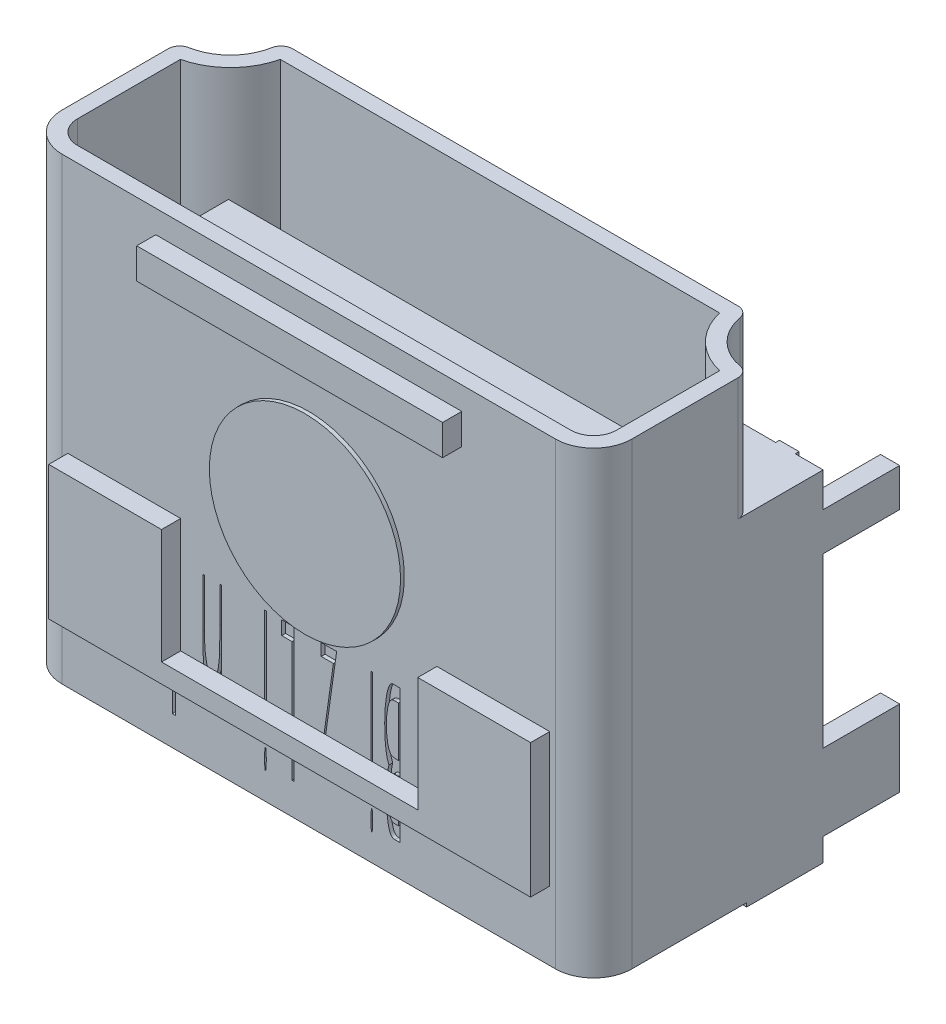
from build123d import *

# Parameters (mm, degrees)
SKETCH_1_W                     = 14.9
SKETCH_1_H                     = 12
EXTRUDE_1_DEPTH                = 6
FILLET_1_R                     = 1
SKETCH_2_W                     = 14.9
SKETCH_2_H                     = 0.6
CUT_EXTRUDE_1_DEPTH            = 3.2
SKETCH_3_R                     = 1.352822973
CUT_EXTRUDE_2_DEPTH            = 3.2
FILLET_2_R                     = 0.3
CUT_EXTRUDE_3_DEPTH            = 6
SKETCH_5_W                     = 10.5
SKETCH_5_H                     = 0.9
EXTRUDE_2_DEPTH                = 4
SKETCH_6_W                     = 0.5
SKETCH_6_H                     = 1
EXTRUDE_3_DEPTH                = 2
SKETCH_7_W                     = 0.5
SKETCH_7_H                     = 2
EXTRUDE_4_DEPTH                = 2
SKETCH_8_W                     = 11
SKETCH_8_H                     = 2
CUT_EXTRUDE_4_DEPTH            = 1.5
SKETCH_9_W                     = 0.3
SKETCH_9_H                     = 2
EXTRUDE_5_DEPTH                = 0.2
SKETCH_10_W                    = 0.3
SKETCH_10_H                    = 1.3
EXTRUDE_6_DEPTH                = 0.2
FILLET_3_R                     = 0.1
PATTERN_LINEAR_1_COUNT         = 21
PATTERN_LINEAR_1_PITCH         = 0.5
FILLET_3_OF_PATTERN_LINEAR_1_R = 0.1
SKETCH_11_W                    = 1.95
SKETCH_11_H                    = 2
EXTRUDE_7_DEPTH                = 0.1
SKETCH_12_W                    = 0.514362924
SKETCH_12_H                    = 8.8
EXTRUDE_8_DEPTH                = 0.1
WRAP_START                     = -0.1
WRAP_2_OUTLINE_W               = 0.044871794
WRAP_2_OUTLINE_H               = 2.557692308
WRAP_2_OUTLINE_W_2             = 0.044871795
WRAP_2_DEPTH                   = 0.1
WRAP_3_DEPTH                   = 0.1
SKETCH_16_W                    = 8
SKETCH_16_H                    = 0.8
EXTRUDE_9_DEPTH                = 0.5
SKETCH_17_R                    = 2.5
EXTRUDE_10_DEPTH               = 0.1


# Read off the part's stored shape, not the designer's step: 包覆2, 包覆3
with BuildPart() as part:
    # 草图1 → 凸台-拉伸1 (new body)
    with BuildSketch(Plane.XY):
        with Locations((7.45, 6)):
            Rectangle(SKETCH_1_W, SKETCH_1_H)
    extrude(amount=EXTRUDE_1_DEPTH)

    # 圆角1
    fillet_1_edges = [part.edges().sort_by_distance(p)[0] for p in [
        (14.9, 6, 6),
        (0, 6, 6),
    ]]
    fillet(fillet_1_edges, radius=FILLET_1_R)

    # 草图2 → 切除-拉伸1 (cut)
    with BuildSketch(Plane(origin=(0, 12, 0), x_dir=(1, 0, 0), z_dir=(0, 1, 0))):
        with Locations((7.45, -0.3)):
            Rectangle(SKETCH_2_W, SKETCH_2_H)
    extrude(amount=-CUT_EXTRUDE_1_DEPTH, mode=Mode.SUBTRACT)

    # 草图3 → 切除-拉伸2 (cut)
    with BuildSketch(Plane(origin=(0, 12, 0), x_dir=(1, 0, 0), z_dir=(0, 1, 0))):
        with Locations((14.9, -0.6)):
            Circle(SKETCH_3_R)
        with Locations((0, -0.6)):
            Circle(SKETCH_3_R)
    extrude(amount=-CUT_EXTRUDE_2_DEPTH, mode=Mode.SUBTRACT)

    # 圆角2
    fillet_2_edges = [part.edges().sort_by_distance(p)[0] for p in [
        (14.9, 10.4, 1.952822973),
        (13.547177027, 10.4, 0.6),
        (0, 10.4, 1.952822973),
        (1.352822973, 10.4, 0.6),
    ]]
    fillet(fillet_2_edges, radius=FILLET_2_R)

    # 草图4 → 切除-拉伸3 (cut)
    with BuildSketch(Plane(origin=(0, 12, 0), x_dir=(1, 0, 0), z_dir=(0, 1, 0))):
        with BuildLine():
            Line((0.4, -2.306572113), (0.4, -5))
            ThreePointArc((0.4, -5), (0.575735931, -5.424264069), (1, -5.6))
            Line((1, -5.6), (13.9, -5.6))
            ThreePointArc((13.9, -5.6), (14.324264069, -5.424264069), (14.5, -5))
            Line((14.5, -5), (14.5, -2.306572113))
            ThreePointArc((14.5, -2.306572113), (13.660566989, -1.839433011), (13.193427887, -1))
            Line((13.193427887, -1), (1.706572113, -1))
            ThreePointArc((1.706572113, -1), (1.239433011, -1.839433011), (0.4, -2.306572113))
        make_face()
    extrude(amount=-CUT_EXTRUDE_3_DEPTH, mode=Mode.SUBTRACT)

    # 草图5 → 凸台-拉伸2 (add)
    with BuildSketch(Plane(origin=(0, 6, 0), x_dir=(1, 0, 0), z_dir=(0, 1, 0))):
        with Locations((7.45, -3.3)):
            Rectangle(SKETCH_5_W, SKETCH_5_H)
    extrude(amount=EXTRUDE_2_DEPTH)

    # 草图6 → 凸台-拉伸3 (add)
    with BuildSketch(Plane(origin=(0, 0, 0), x_dir=(-1, 0, 0), z_dir=(0, 0, -1))):
        with Locations((-14.65, 7.4)):
            Rectangle(SKETCH_6_W, SKETCH_6_H)
        with Locations((-0.25, 7.4)):
            Rectangle(SKETCH_6_W, SKETCH_6_H)
    extrude(amount=EXTRUDE_3_DEPTH)

    # 草图7 → 凸台-拉伸4 (add)
    with BuildSketch(Plane(origin=(0, 0, 0), x_dir=(-1, 0, 0), z_dir=(0, 0, -1))):
        with Locations((-14.65, 1.5)):
            Rectangle(SKETCH_7_W, SKETCH_7_H)
        with Locations((-0.25, 1.5)):
            Rectangle(SKETCH_7_W, SKETCH_7_H)
    extrude(amount=EXTRUDE_4_DEPTH)

    # 草图8 → 切除-拉伸4 (cut)
    with BuildSketch(Plane.XZ):
        with Locations((7.45, 1)):
            Rectangle(SKETCH_8_W, SKETCH_8_H)
    extrude(amount=-CUT_EXTRUDE_4_DEPTH, mode=Mode.SUBTRACT)


with BuildPart() as body_2:
    # 草图9 → 凸台-拉伸5 (new body)
    with BuildSketch(Plane.XZ.offset(-1.5)):
        with Locations((2.5, 1)):
            Rectangle(SKETCH_9_W, SKETCH_9_H)
    extrude_5 = extrude(amount=EXTRUDE_5_DEPTH)


with BuildPart() as body_3:
    # 草图10 → 凸台-拉伸6 (new body)
    with BuildSketch(Plane(origin=(0, 0, 0), x_dir=(-1, 0, 0), z_dir=(0, 0, -1))):
        with Locations((-2.5, 0.85)):
            Rectangle(SKETCH_10_W, SKETCH_10_H)
    extrude_6 = extrude(amount=EXTRUDE_6_DEPTH)

    # 圆角3
    fillet_3_edges = [body_3.edges().sort_by_distance(p)[0] for p in [
        (2.35, 0.2, -0.1),
        (2.65, 0.2, -0.1),
    ]]
    fillet(fillet_3_edges, radius=FILLET_3_R)


with BuildPart() as part_1:
    add(part.part)

    # 阵列(线性)1: 凸台-拉伸5, 凸台-拉伸6 ×21
    with Locations(*[(i * PATTERN_LINEAR_1_PITCH, 0, 0) for i in range(1, PATTERN_LINEAR_1_COUNT)]):
        add(extrude_5)
        add(extrude_6)

    # 圆角3 of 阵列(线性)1
    fillet_3_of_pattern_linear_1_edges = [part_1.edges().sort_by_distance(p)[0] for p in [
        (2.85, 0.2, -0.1),
        (3.15, 0.2, -0.1),
        (3.35, 0.2, -0.1),
        (3.65, 0.2, -0.1),
        (3.85, 0.2, -0.1),
        (4.15, 0.2, -0.1),
        (4.35, 0.2, -0.1),
        (4.65, 0.2, -0.1),
        (4.85, 0.2, -0.1),
        (5.15, 0.2, -0.1),
        (5.35, 0.2, -0.1),
        (5.65, 0.2, -0.1),
        (5.85, 0.2, -0.1),
        (6.15, 0.2, -0.1),
        (6.35, 0.2, -0.1),
        (6.65, 0.2, -0.1),
        (6.85, 0.2, -0.1),
        (7.15, 0.2, -0.1),
        (7.35, 0.2, -0.1),
        (7.65, 0.2, -0.1),
        (7.85, 0.2, -0.1),
        (8.15, 0.2, -0.1),
        (8.35, 0.2, -0.1),
        (8.65, 0.2, -0.1),
        (8.85, 0.2, -0.1),
        (9.15, 0.2, -0.1),
        (9.35, 0.2, -0.1),
        (9.65, 0.2, -0.1),
        (9.85, 0.2, -0.1),
        (10.15, 0.2, -0.1),
        (10.35, 0.2, -0.1),
        (10.65, 0.2, -0.1),
        (10.85, 0.2, -0.1),
        (11.15, 0.2, -0.1),
        (11.35, 0.2, -0.1),
        (11.65, 0.2, -0.1),
        (11.85, 0.2, -0.1),
        (12.15, 0.2, -0.1),
        (12.35, 0.2, -0.1),
        (12.65, 0.2, -0.1),
    ]]
    fillet(fillet_3_of_pattern_linear_1_edges, radius=FILLET_3_OF_PATTERN_LINEAR_1_R)

    # 草图11 → 凸台-拉伸7 (add)
    with BuildSketch(Plane.XZ):
        with Locations((0.975, 1)):
            Rectangle(SKETCH_11_W, SKETCH_11_H)
        with Locations((13.925, 1)):
            Rectangle(SKETCH_11_W, SKETCH_11_H)
    extrude(amount=EXTRUDE_7_DEPTH)

    # 草图12 → 凸台-拉伸8 (add)
    with BuildSketch(Plane(origin=(0, 0, 0), x_dir=(-1, 0, 0), z_dir=(0, 0, -1))):
        with Locations((-0.986599774, 4.4)):
            Rectangle(SKETCH_12_W, SKETCH_12_H)
        with Locations((-13.913400226, 4.4)):
            Rectangle(SKETCH_12_W, SKETCH_12_H)
    extrude(amount=EXTRUDE_8_DEPTH)

    # 包覆2 outline → 包覆2 (cut)
    # profile 1 of 8: a face of its own
    with BuildSketch(Plane.XY.offset(6).offset(WRAP_START)):
        with BuildLine():
            add(Edge.make_bspline(
                [(5.127653544, 2.231309328), (5.120128489, 2.190086865), (5.106127643, 2.11338984), (5.080573314, 2.008013876), (5.055820157, 1.919845149), (5.027786579, 1.849743187), (4.999147669, 1.795513261), (4.969496906, 1.756456903), (4.936784986, 1.73045949), (4.912512621, 1.726804294), (4.901191204, 1.725099392)],
                knots=[0, 0, 0, 0, 0.216322627, 0.40248206, 0.559800951, 0.68865692, 0.791807792, 0.875111536, 0.941747975, 1, 1, 1, 1], degree=3))
            Line((5.127653544, 2.231309328), (5.127653544, 1.769971187))
            Line((5.127653544, 1.769971187), (5.172525339, 1.769971187))
            Line((5.172525339, 1.769971187), (5.172525339, 4.327663495))
            Line((5.172525339, 4.327663495), (5.127653544, 4.327663495))
            Line((5.127653544, 4.327663495), (5.127653544, 3.402883847))
            add(Edge.make_bspline(
                [(5.117136717, 2.71648561), (5.118141634, 2.733776619), (5.120340539, 2.771611863), (5.12227538, 2.83309481), (5.123510434, 2.904385019), (5.124889914, 2.985248055), (5.126514164, 3.075921921), (5.126877491, 3.176188458), (5.127876056, 3.286262328), (5.127729795, 3.362919614), (5.127653544, 3.402883847)],
                knots=[0, 0, 0, 0, 0.075680799, 0.1656006, 0.26876431, 0.387243745, 0.518997301, 0.665035713, 0.825370924, 1, 1, 1, 1], degree=3))
            add(Edge.make_bspline(
                [(4.922224858, 2.039201956), (4.927942359, 2.039756298), (4.94007378, 2.040932504), (4.957314872, 2.051140953), (4.973530839, 2.067143837), (4.988699721, 2.089259602), (5.003159713, 2.116996656), (5.018282565, 2.150267915), (5.031587289, 2.190194601), (5.051033274, 2.252612992), (5.072011625, 2.340441994), (5.092057996, 2.455425088), (5.107328091, 2.582067052), (5.113774701, 2.670412155), (5.117136717, 2.71648561)],
                knots=[0, 0, 0, 0, 0.023338468, 0.049519672, 0.080048927, 0.116511341, 0.158998822, 0.208376928, 0.266319586, 0.331552586, 0.476722505, 0.636472639, 0.810414377, 1, 1, 1, 1], degree=3))
            add(Edge.make_bspline(
                [(4.749047775, 2.542607405), (4.755021423, 2.503284071), (4.766179616, 2.429831905), (4.78671122, 2.327985836), (4.803874752, 2.241064936), (4.822525459, 2.169775389), (4.842033901, 2.113583712), (4.863842906, 2.072756404), (4.890324151, 2.044482028), (4.912204948, 2.04086041), (4.922224858, 2.039201956)],
                knots=[0, 0, 0, 0, 0.215270019, 0.402103472, 0.562391593, 0.694657174, 0.801124103, 0.882722838, 0.94629507, 1, 1, 1, 1], degree=3))
            add(Edge.make_bspline(
                [(4.72380739, 3.124538495), (4.724074831, 3.089716639), (4.72458638, 3.023110932), (4.724788669, 2.92774349), (4.727114487, 2.84150561), (4.729797532, 2.764137428), (4.733287633, 2.69588777), (4.737145917, 2.636455185), (4.742808624, 2.586463153), (4.747120507, 2.556154401), (4.749047775, 2.542607405)],
                knots=[0, 0, 0, 0, 0.179209039, 0.342783127, 0.490761454, 0.623147891, 0.741167577, 0.842453298, 0.929581906, 1, 1, 1, 1], degree=3))
            Line((4.72380739, 3.124538495), (4.72380739, 4.327663495))
            Line((4.72380739, 4.327663495), (4.678935595, 4.327663495))
            Line((4.678935595, 4.327663495), (4.678935595, 3.021473591))
            add(Edge.make_bspline(
                [(4.901191204, 1.725099392), (4.889728657, 1.727147766), (4.864445574, 1.73166589), (4.833210748, 1.764032351), (4.804934892, 1.810179685), (4.778574241, 1.873417221), (4.754703216, 1.951387204), (4.734300328, 2.042707672), (4.715763033, 2.146238159), (4.704646493, 2.24166418), (4.697466662, 2.32708081), (4.692572014, 2.401178914), (4.688459859, 2.483689938), (4.684977772, 2.574842796), (4.682280427, 2.674408291), (4.679927029, 2.782614104), (4.679719787, 2.899245785), (4.67920249, 2.979874098), (4.678935595, 3.021473591)],
                knots=[0, 0, 0, 0, 0.025164909, 0.055506554, 0.094729537, 0.145346904, 0.205900597, 0.274749883, 0.351786244, 0.438069585, 0.486753382, 0.541058617, 0.602030856, 0.669166596, 0.742474368, 0.821960716, 0.908142146, 1, 1, 1, 1], degree=3))
        make_face()
    # profile 2 of 8: a face of its own
    with BuildSketch(Plane.XY.offset(6).offset(WRAP_START)):
        with BuildLine():
            add(Edge.make_bspline(
                [(6.294320211, 0.963681123), (6.294450002, 0.997597906), (6.294690954, 1.060562802), (6.299105423, 1.134690147), (6.303163143, 1.183909667), (6.308004315, 1.208133855), (6.310093913, 1.224659433), (6.3152312, 1.229941705), (6.316756108, 1.231509648)],
                knots=[0, 0, 0, 0, 0.375661886, 0.697398442, 0.824993315, 0.919538613, 0.976116538, 1, 1, 1, 1], degree=3))
            add(Edge.make_bspline(
                [(6.316756108, 0.69304811), (6.315231201, 0.694616054), (6.310093918, 0.699898326), (6.308004246, 0.716423894), (6.303163653, 0.740648156), (6.299081776, 0.790101123), (6.294674896, 0.86516273), (6.294444843, 0.929062743), (6.294320211, 0.963681123)],
                knots=[0, 0, 0, 0, 0.02363863, 0.079636568, 0.173212671, 0.299499553, 0.620497877, 1, 1, 1, 1], degree=3))
            add(Edge.make_bspline(
                [(6.339192005, 0.963681123), (6.33913692, 0.929062513), (6.33903522, 0.865148069), (6.333938788, 0.790074868), (6.329300418, 0.74073799), (6.32564321, 0.716365907), (6.323408473, 0.699899804), (6.318278766, 0.694616392), (6.316756108, 0.69304811)],
                knots=[0, 0, 0, 0, 0.379590806, 0.700817738, 0.827134131, 0.920344822, 0.976355846, 1, 1, 1, 1], degree=3))
            add(Edge.make_bspline(
                [(6.316756108, 1.231509648), (6.318278767, 1.229941366), (6.323408478, 1.224657955), (6.325643129, 1.208191842), (6.329301016, 1.183819837), (6.333911739, 1.134715812), (6.339017393, 1.060577889), (6.339130885, 0.997598244), (6.339192005, 0.963681123)],
                knots=[0, 0, 0, 0, 0.023889072, 0.080480284, 0.174656496, 0.302281334, 0.624249888, 1, 1, 1, 1], degree=3))
        make_face()
    # profile 3 of 8: a face of its own
    with BuildSketch(Plane.XY.offset(6).offset(WRAP_START)):
        with BuildLine():
            add(Edge.make_bspline(
                [(9.076371493, 0.963681123), (9.076501284, 0.997597906), (9.076742236, 1.060562802), (9.081156705, 1.134690147), (9.085214425, 1.183909667), (9.090055597, 1.208133855), (9.092145195, 1.224659433), (9.097282482, 1.229941705), (9.09880739, 1.231509648)],
                knots=[0, 0, 0, 0, 0.375661886, 0.697398442, 0.824993315, 0.919538613, 0.976116538, 1, 1, 1, 1], degree=3))
            add(Edge.make_bspline(
                [(9.09880739, 0.69304811), (9.097282483, 0.694616054), (9.0921452, 0.699898326), (9.090055528, 0.716423894), (9.085214935, 0.740648156), (9.081133058, 0.790101123), (9.076726178, 0.86516273), (9.076496126, 0.929062743), (9.076371493, 0.963681123)],
                knots=[0, 0, 0, 0, 0.02363863, 0.079636568, 0.173212671, 0.299499553, 0.620497877, 1, 1, 1, 1], degree=3))
            add(Edge.make_bspline(
                [(9.121243288, 0.963681123), (9.121188203, 0.929062513), (9.121086502, 0.865148069), (9.11599007, 0.790074868), (9.1113517, 0.74073799), (9.107694492, 0.716365907), (9.105459755, 0.699899804), (9.100330048, 0.694616392), (9.09880739, 0.69304811)],
                knots=[0, 0, 0, 0, 0.379590806, 0.700817738, 0.827134131, 0.920344822, 0.976355846, 1, 1, 1, 1], degree=3))
            add(Edge.make_bspline(
                [(9.09880739, 1.231509648), (9.100330049, 1.229941366), (9.10545976, 1.224657955), (9.107694411, 1.208191842), (9.111352298, 1.183819837), (9.115963021, 1.134715812), (9.121068675, 1.060577889), (9.121182167, 0.997598244), (9.121243288, 0.963681123)],
                knots=[0, 0, 0, 0, 0.023889072, 0.080480284, 0.174656496, 0.302281334, 0.624249888, 1, 1, 1, 1], degree=3))
        make_face()
    # profile 4 of 8: a face of its own
    with BuildSketch(Plane.XY.offset(6).offset(WRAP_START)):
        with BuildLine():
            add(Edge.make_bspline(
                [(9.702473255, 0.827663495), (9.689361522, 0.828836645), (9.663087495, 0.831187469), (9.627300457, 0.852127777), (9.597025494, 0.884543372), (9.572867797, 0.929984612), (9.552308775, 0.987484485), (9.534851985, 1.058138322), (9.517800714, 1.141546745), (9.504543264, 1.237363726), (9.493339304, 1.342575091), (9.486019377, 1.455088667), (9.480778629, 1.573139718), (9.480407104, 1.653812382), (9.480217647, 1.694951155)],
                knots=[0, 0, 0, 0, 0.041202757, 0.082564394, 0.127534759, 0.180171222, 0.24403051, 0.320419336, 0.410168434, 0.513258866, 0.62625458, 0.744823121, 0.869873347, 1, 1, 1, 1], degree=3))
            Line((9.702473255, 0.827663495), (9.839192005, 0.827663495))
            Line((9.839192005, 0.827663495), (9.839192005, 4.327663495))
            Line((9.839192005, 4.327663495), (9.654095852, 4.327663495))
            add(Edge.make_bspline(
                [(9.435345852, 3.334173911), (9.435878113, 3.401033953), (9.436898803, 3.529248134), (9.448477392, 3.713574295), (9.465883325, 3.88196217), (9.487828906, 4.011316923), (9.508238303, 4.104022811), (9.525164052, 4.16276766), (9.542912264, 4.212709986), (9.562493593, 4.253512243), (9.582439437, 4.286123566), (9.604562223, 4.309213987), (9.628199005, 4.325345518), (9.6457059, 4.326912526), (9.654095852, 4.327663495)],
                knots=[0, 0, 0, 0, 0.189667311, 0.363715579, 0.523783743, 0.669746762, 0.735698175, 0.792987671, 0.843123037, 0.88582811, 0.921325644, 0.950867675, 0.976453973, 1, 1, 1, 1], degree=3))
            add(Edge.make_bspline(
                [(9.546123095, 2.439542501), (9.533124484, 2.472456431), (9.505552114, 2.542272738), (9.484652584, 2.637350929), (9.471111351, 2.721922241), (9.46224565, 2.793766647), (9.453744654, 2.871804645), (9.444271596, 2.986967851), (9.436690172, 3.141734527), (9.435804682, 3.268492315), (9.435345852, 3.334173911)],
                knots=[0, 0, 0, 0, 0.116935669, 0.248041384, 0.32088519, 0.400397071, 0.487499346, 0.58061376, 0.78268824, 1, 1, 1, 1], degree=3))
            add(Edge.make_bspline(
                [(9.480217647, 1.694951155), (9.480615961, 1.733512883), (9.481393374, 1.808775889), (9.483686504, 1.918908412), (9.489767284, 2.023593319), (9.496478441, 2.122496801), (9.504942735, 2.214516265), (9.517547538, 2.297556228), (9.529110006, 2.372050377), (9.540660967, 2.417873852), (9.546123095, 2.439542501)],
                knots=[0, 0, 0, 0, 0.154422659, 0.301395044, 0.44103398, 0.574250403, 0.698377081, 0.810871015, 0.910566153, 1, 1, 1, 1], degree=3))
        make_face()
        with BuildLine():
            add(Edge.make_bspline(
                [(9.745942807, 2.308432725), (9.732051154, 2.307710287), (9.705490841, 2.306329012), (9.668169855, 2.293361303), (9.637283131, 2.270941344), (9.612590459, 2.239658877), (9.593209159, 2.199461831), (9.576181524, 2.150418129), (9.560805414, 2.09156599), (9.543068472, 1.998041429), (9.528696379, 1.866672416), (9.526328704, 1.758092791), (9.525089441, 1.701261251)],
                knots=[0, 0, 0, 0, 0.058906388, 0.112626776, 0.165280533, 0.218954987, 0.280257982, 0.354089593, 0.439379634, 0.538534689, 0.758464959, 1, 1, 1, 1], degree=3))
            Line((9.745942807, 2.308432725), (9.794320211, 2.308432725))
            Line((9.794320211, 2.308432725), (9.794320211, 1.186637853))
            Line((9.794320211, 1.186637853), (9.696163159, 1.186637853))
            add(Edge.make_bspline(
                [(9.525089441, 1.701261251), (9.525617897, 1.663385061), (9.526617315, 1.591753346), (9.534203094, 1.490609464), (9.546361291, 1.402154211), (9.563124088, 1.327267858), (9.584892296, 1.266013518), (9.615140318, 1.221831015), (9.652356703, 1.191100627), (9.681641151, 1.18811728), (9.696163159, 1.186637853)],
                knots=[0, 0, 0, 0, 0.194576081, 0.367983634, 0.520810462, 0.652747787, 0.762230891, 0.851843617, 0.926530005, 1, 1, 1, 1], degree=3))
        make_face(mode=Mode.SUBTRACT)
        with BuildLine():
            add(Edge.make_bspline(
                [(9.696163159, 3.968689136), (9.682694928, 3.968073032), (9.656572289, 3.966878052), (9.620661911, 3.952100831), (9.5901644, 3.928644725), (9.567132164, 3.894641391), (9.548547001, 3.852086835), (9.531879232, 3.800071988), (9.516766327, 3.737978519), (9.499039339, 3.639765169), (9.483662086, 3.504062108), (9.481393742, 3.392181805), (9.480217647, 3.334173911)],
                knots=[0, 0, 0, 0, 0.055292941, 0.107244789, 0.157419588, 0.212035101, 0.274630592, 0.348763657, 0.437208163, 0.53825095, 0.760591549, 1, 1, 1, 1], degree=3))
            Line((9.696163159, 3.968689136), (9.794320211, 3.968689136))
            Line((9.794320211, 3.968689136), (9.794320211, 2.667407084))
            Line((9.794320211, 2.667407084), (9.745942807, 2.667407084))
            add(Edge.make_bspline(
                [(9.595201621, 2.70877327), (9.603563895, 2.702194126), (9.621405779, 2.688156759), (9.65665675, 2.676524774), (9.698602065, 2.668750125), (9.729296782, 2.667879326), (9.745942807, 2.667407084)],
                knots=[0, 0, 0, 0, 0.198676213, 0.423898776, 0.687575061, 1, 1, 1, 1], degree=3))
            add(Edge.make_bspline(
                [(9.480217647, 3.334173911), (9.480644591, 3.297707484), (9.481471638, 3.227067344), (9.487141298, 3.124861597), (9.495955605, 3.029583125), (9.508980529, 2.942496548), (9.525128746, 2.865506697), (9.544534226, 2.800821372), (9.566598254, 2.748774785), (9.586358134, 2.721140795), (9.595201621, 2.70877327)],
                knots=[0, 0, 0, 0, 0.169765518, 0.328857556, 0.476422326, 0.61506518, 0.738628322, 0.842220866, 0.929386331, 1, 1, 1, 1], degree=3))
        make_face(mode=Mode.SUBTRACT)
    # profile 5 of 8: a face of its own
    with BuildSketch(Plane.XY.offset(6).offset(WRAP_START)):
        with Locations((6.316756108, 3.048817341)):
            Rectangle(WRAP_2_OUTLINE_W, WRAP_2_OUTLINE_H)
    # profile 6 of 8: a face of its own
    with BuildSketch(Plane.XY.offset(6).offset(WRAP_START)):
        Polygon((7.057140723, 0.827663495), (7.057140723, 4.327663495), (6.743038159, 4.327663495), (6.743038159, 3.968689136), (7.012268929, 3.968689136), (7.012268929, 0.827663495), align=None)
    # profile 7 of 8: a face of its own
    with BuildSketch(Plane.XY.offset(6).offset(WRAP_START)):
        Polygon((7.861327422, 2.084073751), (8.178935595, 4.327663495), (7.775089441, 4.327663495), (7.775089441, 4.01356093), (8.093398736, 4.01356093), (7.775089441, 1.769971187), (8.1340638, 1.769971187), (8.1340638, 2.084073751), align=None)
    # profile 8 of 8: a face of its own
    with BuildSketch(Plane.XY.offset(6).offset(WRAP_START)):
        with Locations((9.09880739, 3.048817341)):
            Rectangle(WRAP_2_OUTLINE_W_2, WRAP_2_OUTLINE_H)
    extrude(amount=WRAP_2_DEPTH, mode=Mode.SUBTRACT)

    # 包覆3 outline → 包覆3 (cut)
    with BuildSketch(Plane.XY.offset(6).offset(WRAP_START)):
        Polygon((3.47875923, 1.802894997), (3.880502019, 2.968860541), (3.880502019, 0.770843715), (3.970245608, 0.770843715), (3.970245608, 4.360587304), (3.880502019, 4.360587304), (3.880502019, 3.059305253), (3.433887435, 4.360587304), (3.34204048, 4.360587304), (3.804780865, 3.014433458), (3.386912275, 1.802894997), align=None)
    extrude(amount=WRAP_3_DEPTH, mode=Mode.SUBTRACT)

    # 草图16 → 凸台-拉伸9 (add)
    with BuildSketch(Plane.XY.offset(6)):
        Polygon((1.15, 5.3), (4.1, 5.3), (4.1, 2.3), (10.8, 2.3), (10.8, 5.3), (13.75, 5.3), (13.75, 1.8), (1.15, 1.8), align=None)
        with Locations((7.45, 11)):
            Rectangle(SKETCH_16_W, SKETCH_16_H)
    extrude(amount=EXTRUDE_9_DEPTH)

    # 草图17 → 凸台-拉伸10 (add)
    with BuildSketch(Plane.XY.offset(6)):
        with Locations(Location((7.45, 6.9, 0), (0, 0, 180))):
            Circle(SKETCH_17_R)
    extrude(amount=EXTRUDE_10_DEPTH)


solid = Compound([body_2.part, body_3.part, part_1.part])
